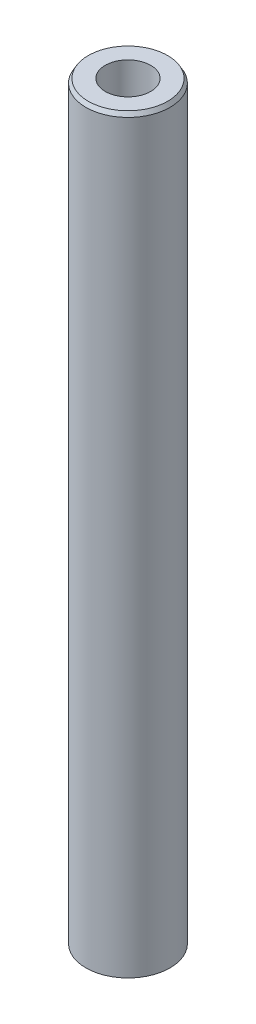
from build123d import *
from OCP.BRepFilletAPI import BRepFilletAPI_MakeChamfer

# Parameters (mm, degrees)
SKETCH1_R           = 20
BOSS_EXTRUDE1_DEPTH = 357.599281503
SKETCH2_R           = 10.805155645
CUT_EXTRUDE1_DEPTH  = 359.71610799
CHAMFER1_SIZE       = 1.955678411
CHAMFER1_SIZE2      = 1.129111457


with BuildPart() as part:
    # Sketch1 → Boss-Extrude1 (new body)
    with BuildSketch(Plane(origin=(0, 0, 0), x_dir=(1, 0, 0), z_dir=(0, 1, 0))):
        Circle(SKETCH1_R)
    extrude(amount=BOSS_EXTRUDE1_DEPTH)

    # Sketch2 → Cut-Extrude1 (cut, through all)
    with BuildSketch(Plane(origin=(0, 0, 0), x_dir=(1, 0, 0), z_dir=(0, 1, 0))):
        Circle(SKETCH2_R)
    extrude(amount=CUT_EXTRUDE1_DEPTH, mode=Mode.SUBTRACT)

    # Chamfer1: one chamfer whose edges measure the first distance from different faces: ONE call of the kernel's chamfer builder (chamfer() names one face for all edges)
    chamfer1_edges_1 = [part.edges().sort_by_distance(p)[0] for p in [
        (-20, 357.599281503, 0),
    ]]
    chamfer1_side_1 = [part.faces().sort_by_distance(p)[0] for p in [
        (-20, 178.799640752, 0),
    ]]
    chamfer1_edges_2 = [part.edges().sort_by_distance(p)[0] for p in [
        (-20, 0, 0),
    ]]
    chamfer1_side_2 = [part.faces().sort_by_distance(p)[0] for p in [
        (-19.434314575, 0, 0),
    ]]
    chamfer1 = BRepFilletAPI_MakeChamfer(part.part.solid().wrapped)
    for e in chamfer1_edges_1:
        chamfer1.Add(CHAMFER1_SIZE, CHAMFER1_SIZE2, e.wrapped, chamfer1_side_1[0].wrapped)  # the first distance lies on this face
    for e in chamfer1_edges_2:
        chamfer1.Add(CHAMFER1_SIZE, CHAMFER1_SIZE2, e.wrapped, chamfer1_side_2[0].wrapped)  # the first distance lies on this face
    add(Compound.cast(chamfer1.Shape()), mode=Mode.REPLACE)


solid = part.part
